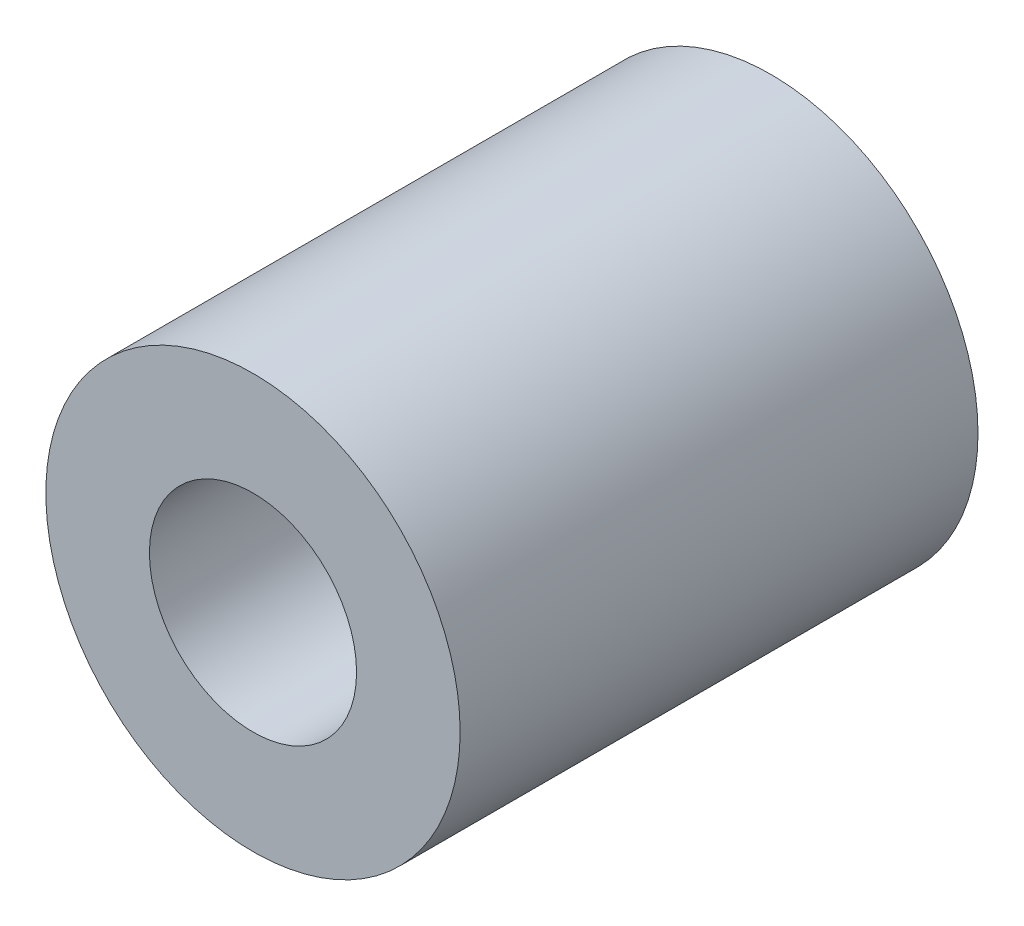
from build123d import *

# Parameters (mm, degrees)
SKETCH1_R           = 6.35
SKETCH1_R_2         = 3.175
BOSS_EXTRUDE1_DEPTH = 7.9375


with BuildPart() as part:
    # Sketch1 → Boss-Extrude1 (new, symmetric)
    with BuildSketch(Plane.XY):
        Circle(SKETCH1_R)
        Circle(SKETCH1_R_2, mode=Mode.SUBTRACT)
    extrude(amount=BOSS_EXTRUDE1_DEPTH, both=True)


solid = part.part
